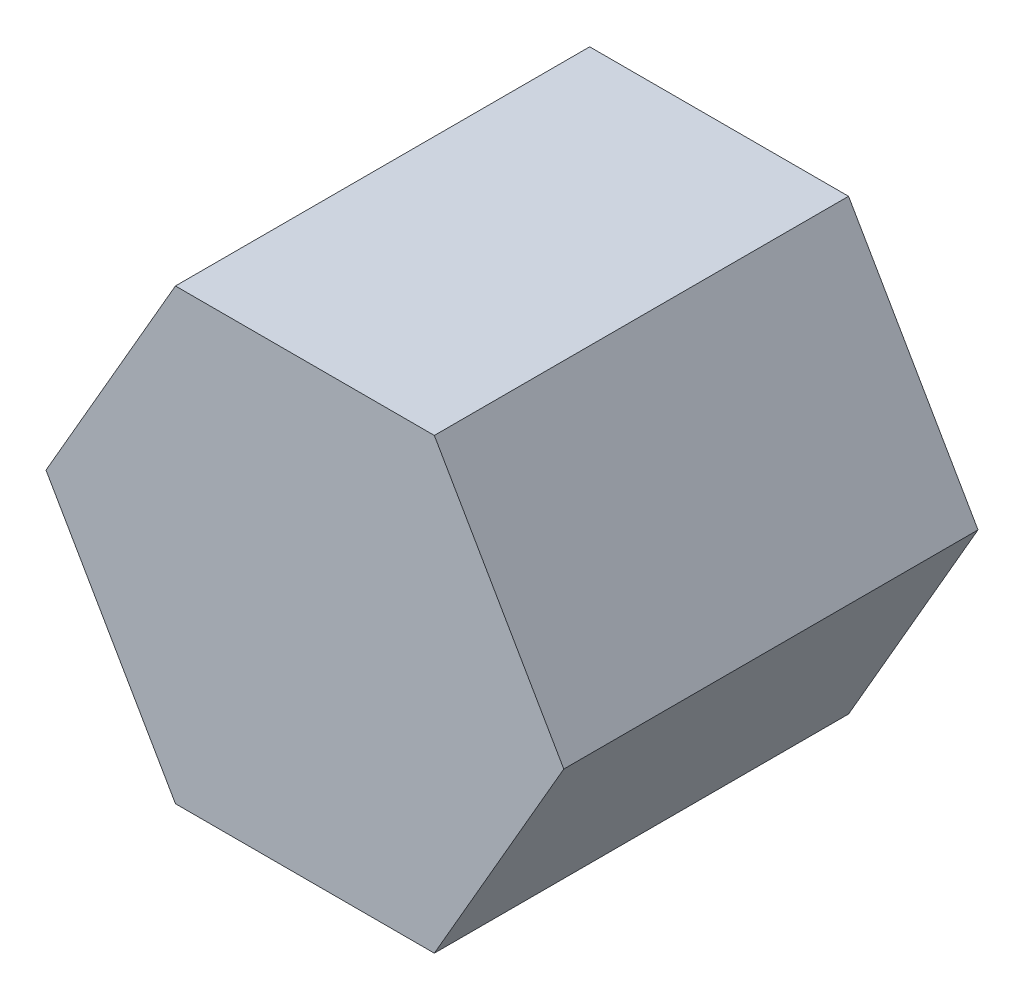
from build123d import *

# Parameters (mm, degrees)
BOSS_EXTRUDE1_DEPTH = 8


with BuildPart() as part:
    # Sketch1 → Boss-Extrude1 (new body)
    with BuildSketch(Plane.XY):
        Polygon((-19.117086356, 22.187903632), (-14.117086356, 22.187903632), (-11.617086356, 17.857776613), (-14.117086356, 13.527649594), (-19.117086356, 13.527649594), (-21.617086356, 17.857776613), align=None)
    extrude(amount=BOSS_EXTRUDE1_DEPTH)


solid = part.part
